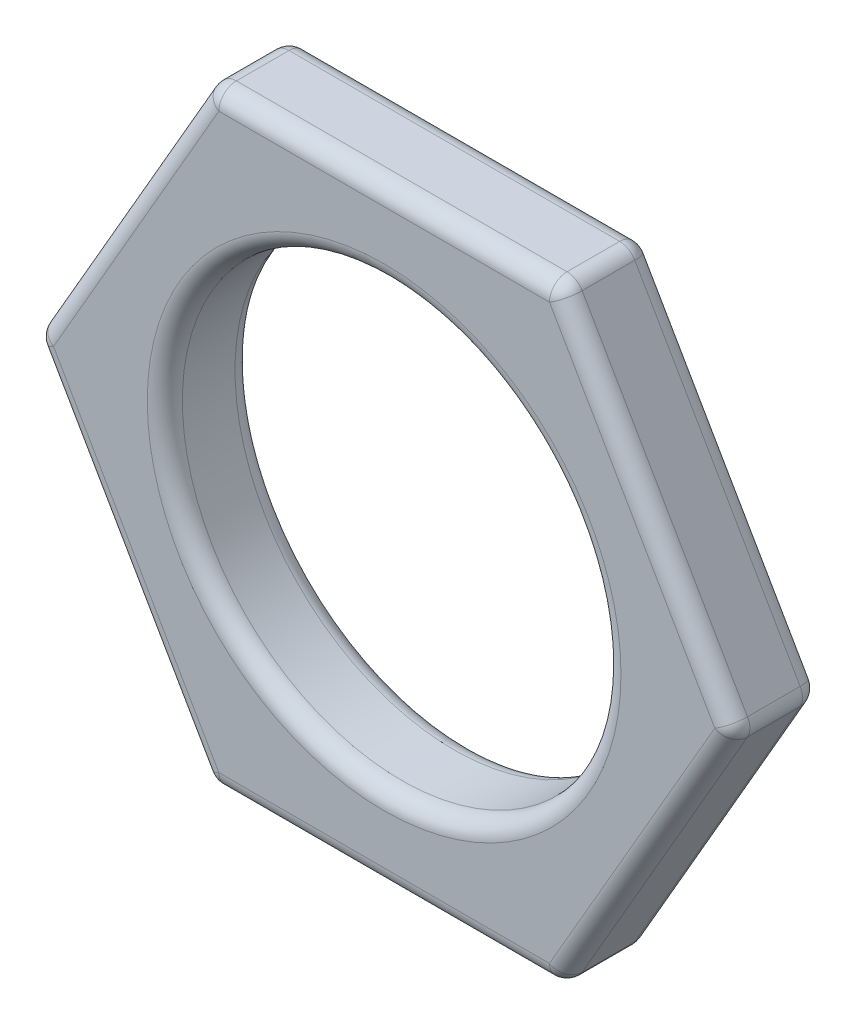
from build123d import *

# Parameters (mm, degrees)
SKETCH1_R      = 3.96875
EXTRUDE1_DEPTH = 1.5875
FILLET4_R      = 0.3175


with BuildPart() as part:
    # Sketch1 → Extrude1 (new body)
    with BuildSketch(Plane.XY):
        Polygon((6.35, 0), (3.175, 5.499261314), (-3.175, 5.499261314), (-6.35, 0), (-3.175, -5.499261314), (3.175, -5.499261314), align=None)
        Circle(SKETCH1_R, mode=Mode.SUBTRACT)
    extrude(amount=EXTRUDE1_DEPTH)

    # Fillet4
    fillet4_edges = [part.edges().sort_by_distance(p)[0] for p in [
        (-3.96875, 0, 0),
        (4.7625, 2.749630657, 0),
        (0, 5.499261314, 0),
        (-4.7625, 2.749630657, 0),
        (-4.7625, -2.749630657, 0),
        (0, -5.499261314, 0),
        (4.7625, -2.749630657, 0),
        (-3.96875, 0, 1.5875),
        (0, -5.499261314, 1.5875),
        (-4.7625, -2.749630657, 1.5875),
        (-4.7625, 2.749630657, 1.5875),
        (0, 5.499261314, 1.5875),
        (4.7625, 2.749630657, 1.5875),
        (4.7625, -2.749630657, 1.5875),
        (3.175, -5.499261314, 0.79375),
        (6.35, 0, 0.79375),
        (3.175, 5.499261314, 0.79375),
        (-3.175, -5.499261314, 0.79375),
        (-3.175, 5.499261314, 0.79375),
        (-6.35, 0, 0.79375),
    ]]
    fillet(fillet4_edges, radius=FILLET4_R)


solid = part.part
